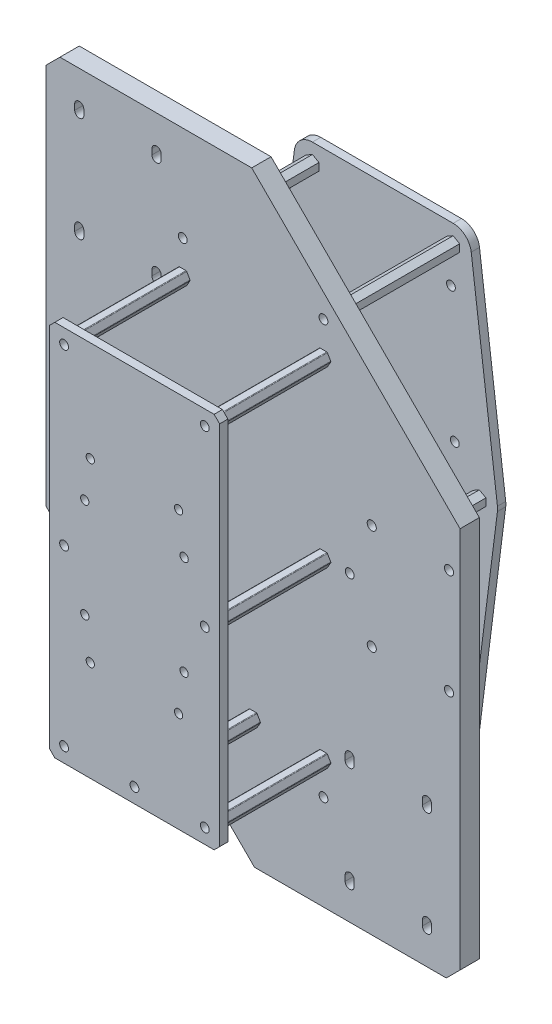
from build123d import *

# Parameters (mm, degrees)
SKETCH_1_W                 = 150
SKETCH_1_H                 = 219
SKETCH_1_R                 = 1.65
SKETCH_1_R_2               = 1.6
EXTRUDE_1_DEPTH            = 7
CUT_EXTRUDE_2_DEPTH        = 133.906922318
CHAMFER_1_SIZE             = 5
CUT_EXTRUDE_3_DEPTH        = 133.906922318
SKETCH_16_R                = 1.25
EXTRUDE_7_DEPTH            = 40
PATTERN_START              = 7
PATTERN_SKETCH_1_OUTLINE_R = 1.25
PATTERN_SKETCH_1_DEPTH     = 40
SKETCH_18_W                = 61.734272208
SKETCH_18_H                = 136.7
SKETCH_18_R                = 1.6
SKETCH_18_R_2              = 1.5
EXTRUDE_8_DEPTH            = 3
CHAMFER_2_SIZE             = 2
EXTRUDE_9_DEPTH            = 40
EXTRUDE_9_2_DEPTH          = 40
EXTRUDE_9_3_DEPTH          = 40
EXTRUDE_9_4_DEPTH          = 40
EXTRUDE_9_5_DEPTH          = 40
EXTRUDE_9_6_DEPTH          = 40
SKETCH_23_R                = 1.6
EXTRUDE_10_DEPTH           = 3
SKETCH_24_R                = 1.6
CUT_EXTRUDE_4_DEPTH        = 163.062487948


# Read off the part's stored shape, not the designer's step: 草图阵列1
with BuildPart() as part:
    # 草图1 → 凸台-拉伸1 (new body)
    with BuildSketch(Plane.XY):
        Rectangle(SKETCH_1_W, SKETCH_1_H)
        with Locations((-63, 96.5)):
            Circle(SKETCH_1_R, mode=Mode.SUBTRACT)
        with Locations((-63, 58.5)):
            Circle(SKETCH_1_R, mode=Mode.SUBTRACT)
        with Locations((-35, 96.5)):
            Circle(SKETCH_1_R, mode=Mode.SUBTRACT)
        with Locations((-35, 58.5)):
            Circle(SKETCH_1_R, mode=Mode.SUBTRACT)
        with Locations((-43, 19)):
            Circle(SKETCH_1_R, mode=Mode.SUBTRACT)
        with Locations((-71, 19)):
            Circle(SKETCH_1_R, mode=Mode.SUBTRACT)
        with Locations((-71, -19)):
            Circle(SKETCH_1_R, mode=Mode.SUBTRACT)
        with Locations((-43, -19)):
            Circle(SKETCH_1_R, mode=Mode.SUBTRACT)
        with Locations(Location((71, -19, 0), (0, 0, 180))):
            Circle(SKETCH_1_R, mode=Mode.SUBTRACT)
        with Locations(Location((43, -19, 0), (0, 0, 180))):
            Circle(SKETCH_1_R, mode=Mode.SUBTRACT)
        with Locations(Location((43, 19, 0), (0, 0, 180))):
            Circle(SKETCH_1_R, mode=Mode.SUBTRACT)
        with Locations(Location((71, 19, 0), (0, 0, 180))):
            Circle(SKETCH_1_R, mode=Mode.SUBTRACT)
        with Locations(Location((35, -96.5, 0), (0, 0, 180))):
            Circle(SKETCH_1_R, mode=Mode.SUBTRACT)
        with Locations(Location((35, -58.5, 0), (0, 0, 180))):
            Circle(SKETCH_1_R, mode=Mode.SUBTRACT)
        with Locations(Location((63, -58.5, 0), (0, 0, 180))):
            Circle(SKETCH_1_R, mode=Mode.SUBTRACT)
        with Locations(Location((63, -96.5, 0), (0, 0, 180))):
            Circle(SKETCH_1_R, mode=Mode.SUBTRACT)
        with Locations((-25.5, 63)):
            Circle(SKETCH_1_R_2, mode=Mode.SUBTRACT)
        with Locations((25.5, 63)):
            Circle(SKETCH_1_R_2, mode=Mode.SUBTRACT)
        with Locations((25.5, -63)):
            Circle(SKETCH_1_R_2, mode=Mode.SUBTRACT)
        with Locations((-25.5, -63)):
            Circle(SKETCH_1_R_2, mode=Mode.SUBTRACT)
        with Locations((-25.5, 0)):
            Circle(SKETCH_1_R_2, mode=Mode.SUBTRACT)
        with Locations((25.5, 0)):
            Circle(SKETCH_1_R_2, mode=Mode.SUBTRACT)
        with Locations((0, -63)):
            Circle(SKETCH_1_R_2, mode=Mode.SUBTRACT)
        with Locations((-35, 0)):
            Circle(SKETCH_1_R_2, mode=Mode.SUBTRACT)
        with Locations(Location((35, 0, 0), (0, 0, 180))):
            Circle(SKETCH_1_R_2, mode=Mode.SUBTRACT)
        with Locations((-25.5, 75)):
            Circle(SKETCH_1_R_2, mode=Mode.SUBTRACT)
        with Locations(Location((25.5, 75, 0), (0, 0, 180))):
            Circle(SKETCH_1_R_2, mode=Mode.SUBTRACT)
        with Locations((25.5, -75)):
            Circle(SKETCH_1_R_2, mode=Mode.SUBTRACT)
        with Locations(Location((-25.5, -75, 0), (0, 0, 180))):
            Circle(SKETCH_1_R_2, mode=Mode.SUBTRACT)
    extrude(amount=EXTRUDE_1_DEPTH)

    # 草图11 → 切除-拉伸2 (cut, through all)
    with BuildSketch(Plane.XY.offset(7)):
        Polygon((-75, -34), (0.5, -109.5), (-75, -109.5), align=None)
        Polygon((-0.5, 109.5), (75, 34), (75, 109.5), align=None)
    extrude(amount=-CUT_EXTRUDE_2_DEPTH, mode=Mode.SUBTRACT)

    # 倒角1
    chamfer_1_edges = [part.edges().sort_by_distance(p)[0] for p in [
        (-75, 109.5, 3.5),
        (75, -109.5, 3.5),
    ]]
    chamfer(chamfer_1_edges, length=CHAMFER_1_SIZE)

    # 草图19 → 切除-拉伸3 (cut, through all)
    with BuildSketch(Plane.XY.offset(7)):
        with BuildLine():
            Line((-64.65, 95.5), (-64.65, 97.5))
            ThreePointArc((-64.65, 97.5), (-63, 99.15), (-61.35, 97.5))
            Line((-61.35, 97.5), (-61.35, 95.5))
            ThreePointArc((-61.35, 95.5), (-63, 93.85), (-64.65, 95.5))
        make_face()
        with BuildLine():
            Line((-36.65, 95.5), (-36.65, 97.5))
            ThreePointArc((-36.65, 97.5), (-35, 99.15), (-33.35, 97.5))
            Line((-33.35, 97.5), (-33.35, 95.5))
            ThreePointArc((-33.35, 95.5), (-35, 93.85), (-36.65, 95.5))
        make_face()
        with BuildLine():
            Line((-64.65, 57.5), (-64.65, 59.5))
            ThreePointArc((-64.65, 59.5), (-63, 61.15), (-61.35, 59.5))
            Line((-61.35, 59.5), (-61.35, 57.5))
            ThreePointArc((-61.35, 57.5), (-63, 55.85), (-64.65, 57.5))
        make_face()
        with BuildLine():
            Line((-36.65, 57.5), (-36.65, 59.5))
            ThreePointArc((-36.65, 59.5), (-35, 61.15), (-33.35, 59.5))
            Line((-33.35, 59.5), (-33.35, 57.5))
            ThreePointArc((-33.35, 57.5), (-35, 55.85), (-36.65, 57.5))
        make_face()
        with BuildLine():
            Line((36.65, -57.5), (36.65, -59.5))
            ThreePointArc((36.65, -59.5), (35, -61.15), (33.35, -59.5))
            Line((33.35, -59.5), (33.35, -57.5))
            ThreePointArc((33.35, -57.5), (35, -55.85), (36.65, -57.5))
        make_face()
        with BuildLine():
            Line((64.65, -57.5), (64.65, -59.5))
            ThreePointArc((64.65, -59.5), (63, -61.15), (61.35, -59.5))
            Line((61.35, -59.5), (61.35, -57.5))
            ThreePointArc((61.35, -57.5), (63, -55.85), (64.65, -57.5))
        make_face()
        with BuildLine():
            Line((33.35, -97.5), (33.35, -95.5))
            ThreePointArc((33.35, -95.5), (35, -93.85), (36.65, -95.5))
            Line((36.65, -95.5), (36.65, -97.5))
            ThreePointArc((36.65, -97.5), (35, -99.15), (33.35, -97.5))
        make_face()
        with BuildLine():
            Line((61.35, -97.5), (61.35, -95.5))
            ThreePointArc((61.35, -95.5), (63, -93.85), (64.65, -95.5))
            Line((64.65, -95.5), (64.65, -97.5))
            ThreePointArc((64.65, -97.5), (63, -99.15), (61.35, -97.5))
        make_face()
    extrude(amount=-CUT_EXTRUDE_3_DEPTH, mode=Mode.SUBTRACT)


with BuildPart() as body_2:
    # 草图16 → 凸台-拉伸7 (new body)
    with BuildSketch(Plane.XY.offset(7)):
        with BuildLine():
            Line((-24.316431948, 65.35), (-26.683568052, 65.35))
            ThreePointArc((-26.683568052, 65.35), (-26.833568052, 65.309807621), (-26.943375673, 65.2))
            Line((-26.943375673, 65.2), (-28.126943725, 63.15))
            ThreePointArc((-28.126943725, 63.15), (-28.167136104, 63), (-28.126943725, 62.85))
            Line((-28.126943725, 62.85), (-26.943375673, 60.8))
            ThreePointArc((-26.943375673, 60.8), (-26.833568052, 60.690192379), (-26.683568052, 60.65))
            Line((-26.683568052, 60.65), (-24.316431948, 60.65))
            ThreePointArc((-24.316431948, 60.65), (-24.166431948, 60.690192379), (-24.056624327, 60.8))
            Line((-24.056624327, 60.8), (-22.873056275, 62.85))
            ThreePointArc((-22.873056275, 62.85), (-22.832863896, 63), (-22.873056275, 63.15))
            Line((-22.873056275, 63.15), (-24.056624327, 65.2))
            ThreePointArc((-24.056624327, 65.2), (-24.166431948, 65.309807621), (-24.316431948, 65.35))
        make_face()
        with Locations((-25.5, 63)):
            Circle(SKETCH_16_R, mode=Mode.SUBTRACT)
    extrude(amount=EXTRUDE_7_DEPTH)


with BuildPart() as body_3:
    # 草图阵列1 outline → 草图阵列1 (new body)
    # profile 1 of 6: a face of its own
    with BuildSketch(Plane.XY.offset(PATTERN_START)):
        with BuildLine():
            ThreePointArc((26.943375673, 2.2), (26.833568052, 2.309807621), (26.683568052, 2.35))
            Line((26.683568052, 2.35), (24.316431948, 2.35))
            ThreePointArc((24.316431948, 2.35), (24.166431948, 2.309807621), (24.056624327, 2.2))
            Line((24.056624327, 2.2), (22.873056275, 0.15))
            ThreePointArc((22.873056275, 0.15), (22.832863896, 0), (22.873056275, -0.15))
            Line((22.873056275, -0.15), (24.056624327, -2.2))
            ThreePointArc((24.056624327, -2.2), (24.166431948, -2.309807621), (24.316431948, -2.35))
            Line((24.316431948, -2.35), (26.683568052, -2.35))
            ThreePointArc((26.683568052, -2.35), (26.833568052, -2.309807621), (26.943375673, -2.2))
            Line((26.943375673, -2.2), (28.126943725, -0.15))
            ThreePointArc((28.126943725, -0.15), (28.167136104, 0), (28.126943725, 0.15))
            Line((28.126943725, 0.15), (26.943375673, 2.2))
        make_face()
        with Locations((25.5, 0)):
            Circle(PATTERN_SKETCH_1_OUTLINE_R, mode=Mode.SUBTRACT)
    # profile 2 of 6: a face of its own
    with BuildSketch(Plane.XY.offset(PATTERN_START)):
        with BuildLine():
            Line((-24.316431948, 2.35), (-26.683568052, 2.35))
            ThreePointArc((-26.683568052, 2.35), (-26.833568052, 2.309807621), (-26.943375673, 2.2))
            Line((-26.943375673, 2.2), (-28.126943725, 0.15))
            ThreePointArc((-28.126943725, 0.15), (-28.167136104, 0), (-28.126943725, -0.15))
            Line((-28.126943725, -0.15), (-26.943375673, -2.2))
            ThreePointArc((-26.943375673, -2.2), (-26.833568052, -2.309807621), (-26.683568052, -2.35))
            Line((-26.683568052, -2.35), (-24.316431948, -2.35))
            ThreePointArc((-24.316431948, -2.35), (-24.166431948, -2.309807621), (-24.056624327, -2.2))
            Line((-24.056624327, -2.2), (-22.873056275, -0.15))
            ThreePointArc((-22.873056275, -0.15), (-22.832863896, 0), (-22.873056275, 0.15))
            Line((-22.873056275, 0.15), (-24.056624327, 2.2))
            ThreePointArc((-24.056624327, 2.2), (-24.166431948, 2.309807621), (-24.316431948, 2.35))
        make_face()
        with Locations((-25.5, 0)):
            Circle(PATTERN_SKETCH_1_OUTLINE_R, mode=Mode.SUBTRACT)
    # profile 3 of 6: a face of its own
    with BuildSketch(Plane.XY.offset(PATTERN_START)):
        with BuildLine():
            ThreePointArc((1.443375673, -60.8), (1.333568052, -60.690192379), (1.183568052, -60.65))
            Line((1.183568052, -60.65), (-1.183568052, -60.65))
            ThreePointArc((-1.183568052, -60.65), (-1.333568052, -60.690192379), (-1.443375673, -60.8))
            Line((-1.443375673, -60.8), (-2.626943725, -62.85))
            ThreePointArc((-2.626943725, -62.85), (-2.667136104, -63), (-2.626943725, -63.15))
            Line((-2.626943725, -63.15), (-1.443375673, -65.2))
            ThreePointArc((-1.443375673, -65.2), (-1.333568052, -65.309807621), (-1.183568052, -65.35))
            Line((-1.183568052, -65.35), (1.183568052, -65.35))
            ThreePointArc((1.183568052, -65.35), (1.333568052, -65.309807621), (1.443375673, -65.2))
            Line((1.443375673, -65.2), (2.626943725, -63.15))
            ThreePointArc((2.626943725, -63.15), (2.667136104, -63), (2.626943725, -62.85))
            Line((2.626943725, -62.85), (1.443375673, -60.8))
        make_face()
        with Locations((0, -63)):
            Circle(PATTERN_SKETCH_1_OUTLINE_R, mode=Mode.SUBTRACT)
    # profile 4 of 6: a face of its own
    with BuildSketch(Plane.XY.offset(PATTERN_START)):
        with BuildLine():
            Line((-24.316431948, -60.65), (-26.683568052, -60.65))
            ThreePointArc((-26.683568052, -60.65), (-26.833568052, -60.690192379), (-26.943375673, -60.8))
            Line((-26.943375673, -60.8), (-28.126943725, -62.85))
            ThreePointArc((-28.126943725, -62.85), (-28.167136104, -63), (-28.126943725, -63.15))
            Line((-28.126943725, -63.15), (-26.943375673, -65.2))
            ThreePointArc((-26.943375673, -65.2), (-26.833568052, -65.309807621), (-26.683568052, -65.35))
            Line((-26.683568052, -65.35), (-24.316431948, -65.35))
            ThreePointArc((-24.316431948, -65.35), (-24.166431948, -65.309807621), (-24.056624327, -65.2))
            Line((-24.056624327, -65.2), (-22.873056275, -63.15))
            ThreePointArc((-22.873056275, -63.15), (-22.832863896, -63), (-22.873056275, -62.85))
            Line((-22.873056275, -62.85), (-24.056624327, -60.8))
            ThreePointArc((-24.056624327, -60.8), (-24.166431948, -60.690192379), (-24.316431948, -60.65))
        make_face()
        with Locations((-25.5, -63)):
            Circle(PATTERN_SKETCH_1_OUTLINE_R, mode=Mode.SUBTRACT)
    # profile 5 of 6: a face of its own
    with BuildSketch(Plane.XY.offset(PATTERN_START)):
        with BuildLine():
            Line((26.683568052, -60.65), (24.316431948, -60.65))
            ThreePointArc((24.316431948, -60.65), (24.166431948, -60.690192379), (24.056624327, -60.8))
            Line((24.056624327, -60.8), (22.873056275, -62.85))
            ThreePointArc((22.873056275, -62.85), (22.832863896, -63), (22.873056275, -63.15))
            Line((22.873056275, -63.15), (24.056624327, -65.2))
            ThreePointArc((24.056624327, -65.2), (24.166431948, -65.309807621), (24.316431948, -65.35))
            Line((24.316431948, -65.35), (26.683568052, -65.35))
            ThreePointArc((26.683568052, -65.35), (26.833568052, -65.309807621), (26.943375673, -65.2))
            Line((26.943375673, -65.2), (28.126943725, -63.15))
            ThreePointArc((28.126943725, -63.15), (28.167136104, -63), (28.126943725, -62.85))
            Line((28.126943725, -62.85), (26.943375673, -60.8))
            ThreePointArc((26.943375673, -60.8), (26.833568052, -60.690192379), (26.683568052, -60.65))
        make_face()
        with Locations((25.5, -63)):
            Circle(PATTERN_SKETCH_1_OUTLINE_R, mode=Mode.SUBTRACT)
    # profile 6 of 6: a face of its own
    with BuildSketch(Plane.XY.offset(PATTERN_START)):
        with BuildLine():
            ThreePointArc((26.943375673, 65.2), (26.833568052, 65.309807621), (26.683568052, 65.35))
            Line((26.683568052, 65.35), (24.316431948, 65.35))
            ThreePointArc((24.316431948, 65.35), (24.166431948, 65.309807621), (24.056624327, 65.2))
            Line((24.056624327, 65.2), (22.873056275, 63.15))
            ThreePointArc((22.873056275, 63.15), (22.832863896, 63), (22.873056275, 62.85))
            Line((22.873056275, 62.85), (24.056624327, 60.8))
            ThreePointArc((24.056624327, 60.8), (24.166431948, 60.690192379), (24.316431948, 60.65))
            Line((24.316431948, 60.65), (26.683568052, 60.65))
            ThreePointArc((26.683568052, 60.65), (26.833568052, 60.690192379), (26.943375673, 60.8))
            Line((26.943375673, 60.8), (28.126943725, 62.85))
            ThreePointArc((28.126943725, 62.85), (28.167136104, 63), (28.126943725, 63.15))
            Line((28.126943725, 63.15), (26.943375673, 65.2))
        make_face()
        with Locations((25.5, 63)):
            Circle(PATTERN_SKETCH_1_OUTLINE_R, mode=Mode.SUBTRACT)
    extrude(amount=PATTERN_SKETCH_1_DEPTH)


with BuildPart() as body_4:
    # 草图18 → 凸台-拉伸8 (new body)
    with BuildSketch(Plane.XY.offset(47)):
        Rectangle(SKETCH_18_W, SKETCH_18_H)
        with Locations((25.5, -63)):
            Circle(SKETCH_18_R, mode=Mode.SUBTRACT)
        with Locations((0, -63)):
            Circle(SKETCH_18_R, mode=Mode.SUBTRACT)
        with Locations((-25.5, -63)):
            Circle(SKETCH_18_R, mode=Mode.SUBTRACT)
        with Locations((25.5, 0)):
            Circle(SKETCH_18_R, mode=Mode.SUBTRACT)
        with Locations((-25.5, 0)):
            Circle(SKETCH_18_R, mode=Mode.SUBTRACT)
        with Locations((-25.5, 63)):
            Circle(SKETCH_18_R, mode=Mode.SUBTRACT)
        with Locations((25.5, 63)):
            Circle(SKETCH_18_R, mode=Mode.SUBTRACT)
        with Locations((-18, 18)):
            Circle(SKETCH_18_R_2, mode=Mode.SUBTRACT)
        with Locations((18, 18)):
            Circle(SKETCH_18_R_2, mode=Mode.SUBTRACT)
        with Locations((-18, -18)):
            Circle(SKETCH_18_R_2, mode=Mode.SUBTRACT)
        with Locations((18, -18)):
            Circle(SKETCH_18_R_2, mode=Mode.SUBTRACT)
        with Locations((-16, 32)):
            Circle(SKETCH_18_R_2, mode=Mode.SUBTRACT)
        with Locations((16, 32)):
            Circle(SKETCH_18_R_2, mode=Mode.SUBTRACT)
        with Locations((-16, -32)):
            Circle(SKETCH_18_R_2, mode=Mode.SUBTRACT)
        with Locations((16, -32)):
            Circle(SKETCH_18_R_2, mode=Mode.SUBTRACT)
    extrude(amount=EXTRUDE_8_DEPTH)

    # 倒角2
    chamfer_2_edges = [body_4.edges().sort_by_distance(p)[0] for p in [
        (30.867136104, -68.35, 48.5),
        (-30.867136104, -68.35, 48.5),
        (-30.867136104, 68.35, 48.5),
        (30.867136104, 68.35, 48.5),
    ]]
    chamfer(chamfer_2_edges, length=CHAMFER_2_SIZE)


with BuildPart() as body_5:
    # 草图22 → 凸台-拉伸9 (new body)
    with BuildSketch(Plane(origin=(0, 0, 0), x_dir=(-1, 0, 0), z_dir=(0, 0, -1))):
        Polygon((-27.85, 73.643226867), (-25.5, 72.286453735), (-23.15, 73.643226867), (-23.15, 76.356773133), (-25.5, 77.713546265), (-27.85, 76.356773133), align=None)
    extrude(amount=EXTRUDE_9_DEPTH)


with BuildPart() as body_6:
    # 草图22 → Extrude 9 2 (new body)
    with BuildSketch(Plane(origin=(0, 0, 0), x_dir=(-1, 0, 0), z_dir=(0, 0, -1))):
        Polygon((-35, -2.713546265), (-32.65, -1.356773133), (-32.65, 1.356773133), (-35, 2.713546265), (-37.35, 1.356773133), (-37.35, -1.356773133), align=None)
    extrude(amount=EXTRUDE_9_2_DEPTH)


with BuildPart() as body_7:
    # 草图22 → Extrude 9 3 (new body)
    with BuildSketch(Plane(origin=(0, 0, 0), x_dir=(-1, 0, 0), z_dir=(0, 0, -1))):
        Polygon((27.85, 76.356773133), (27.85, 73.643226867), (25.5, 72.286453735), (23.15, 73.643226867), (23.15, 76.356773133), (25.5, 77.713546265), align=None)
    extrude(amount=EXTRUDE_9_3_DEPTH)


with BuildPart() as body_8:
    # 草图22 → Extrude 9 4 (new body)
    with BuildSketch(Plane(origin=(0, 0, 0), x_dir=(-1, 0, 0), z_dir=(0, 0, -1))):
        Polygon((37.35, -1.356773133), (35, -2.713546265), (32.65, -1.356773133), (32.65, 1.356773133), (35, 2.713546265), (37.35, 1.356773133), align=None)
    extrude(amount=EXTRUDE_9_4_DEPTH)


with BuildPart() as body_9:
    # 草图22 → Extrude 9 5 (new body)
    with BuildSketch(Plane(origin=(0, 0, 0), x_dir=(-1, 0, 0), z_dir=(0, 0, -1))):
        Polygon((25.5, -77.713546265), (27.85, -76.356773133), (27.85, -73.643226867), (25.5, -72.286453735), (23.15, -73.643226867), (23.15, -76.356773133), align=None)
    extrude(amount=EXTRUDE_9_5_DEPTH)


with BuildPart() as body_10:
    # 草图22 → Extrude 9 6 (new body)
    with BuildSketch(Plane(origin=(0, 0, 0), x_dir=(-1, 0, 0), z_dir=(0, 0, -1))):
        Polygon((-27.85, -76.356773133), (-27.85, -73.643226867), (-25.5, -72.286453735), (-23.15, -73.643226867), (-23.15, -76.356773133), (-25.5, -77.713546265), align=None)
    extrude(amount=EXTRUDE_9_6_DEPTH)


with BuildPart() as body_11:
    # 草图23 → 凸台-拉伸10 (new body)
    with BuildSketch(Plane(origin=(0, 0, -40), x_dir=(-1, 0, 0), z_dir=(0, 0, -1))):
        with BuildLine():
            Line((-25.5, 81.6), (25.5, 81.6))
            ThreePointArc((25.5, 81.6), (29.863836489, 79.951457472), (32.047682058, 75.829373061))
            Line((32.047682058, 75.829373061), (41.547682058, 0.829373061))
            ThreePointArc((41.547682058, 0.829373061), (41.6, 0), (41.547682058, -0.829373061))
            Line((41.547682058, -0.829373061), (32.047682058, -75.829373061))
            ThreePointArc((32.047682058, -75.829373061), (29.863836489, -79.951457472), (25.5, -81.6))
            Line((25.5, -81.6), (-25.5, -81.6))
            ThreePointArc((-25.5, -81.6), (-29.863836489, -79.951457472), (-32.047682058, -75.829373061))
            Line((-32.047682058, -75.829373061), (-41.547682058, -0.829373061))
            ThreePointArc((-41.547682058, -0.829373061), (-41.6, 0), (-41.547682058, 0.829373061))
            Line((-41.547682058, 0.829373061), (-32.047682058, 75.829373061))
            ThreePointArc((-32.047682058, 75.829373061), (-29.863836489, 79.951457472), (-25.5, 81.6))
        make_face()
        with Locations((25.5, 75)):
            Circle(SKETCH_23_R, mode=Mode.SUBTRACT)
        with Locations((-25.5, 75)):
            Circle(SKETCH_23_R, mode=Mode.SUBTRACT)
        with Locations((35, 0)):
            Circle(SKETCH_23_R, mode=Mode.SUBTRACT)
        with Locations((-35, 0)):
            Circle(SKETCH_23_R, mode=Mode.SUBTRACT)
        with Locations((-25.5, -75)):
            Circle(SKETCH_23_R, mode=Mode.SUBTRACT)
        with Locations((25.5, -75)):
            Circle(SKETCH_23_R, mode=Mode.SUBTRACT)
    extrude(amount=EXTRUDE_10_DEPTH)

    # 草图24 → 切除-拉伸4 (cut, through all)
    with BuildSketch(Plane(origin=(0, 0, -43), x_dir=(-1, 0, 0), z_dir=(0, 0, -1))):
        with Locations((26.1, -46.5)):
            Circle(SKETCH_24_R)
        with Locations((-24.7, -61.65)):
            Circle(SKETCH_24_R)
        with Locations((-26.1, -13.35)):
            Circle(SKETCH_24_R)
        with Locations((26.1, -18.55)):
            Circle(SKETCH_24_R)
        with Locations((-24.7, 61.65)):
            Circle(SKETCH_24_R)
        with Locations((26.1, 46.5)):
            Circle(SKETCH_24_R)
        with Locations((26.1, 18.55)):
            Circle(SKETCH_24_R)
        with Locations((-26.1, 13.35)):
            Circle(SKETCH_24_R)
    extrude(amount=-CUT_EXTRUDE_4_DEPTH, mode=Mode.SUBTRACT)


solid = Compound([part.part, body_2.part, body_3.part, body_4.part, body_5.part, body_6.part, body_7.part, body_8.part, body_9.part, body_10.part, body_11.part])
